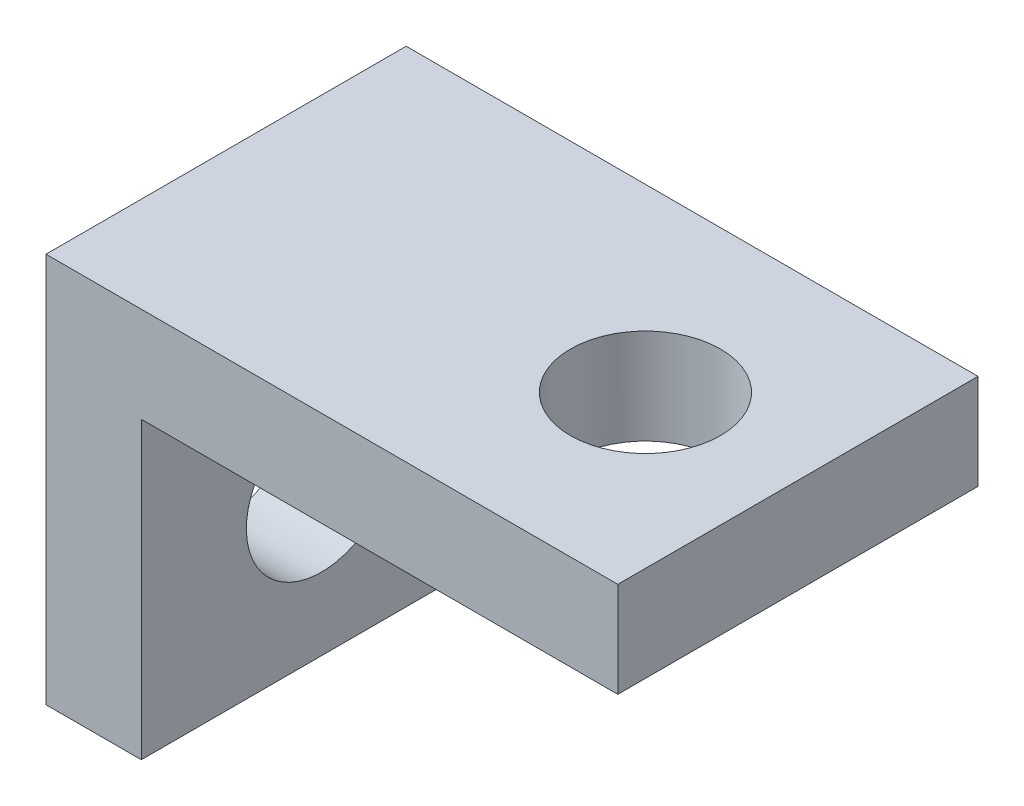
from build123d import *

# Parameters (mm, degrees)
BOSS_EXTRUDE1_DEPTH = 6
SKETCH2_R           = 1.25
CUT_EXTRUDE1_DEPTH  = 6
SKETCH3_R           = 1.25
CUT_EXTRUDE2_DEPTH  = 6


with BuildPart() as part:
    # Sketch1 → Boss-Extrude1 (new body)
    with BuildSketch(Plane.XY):
        Polygon((-0.381, 2.50825), (-0.381, -3.99175), (1.2065, -3.99175), (1.2065, 0.92075), (9.144, 0.92075), (9.144, 2.50825), align=None)
    extrude(amount=BOSS_EXTRUDE1_DEPTH)

    # Sketch2 → Cut-Extrude1 (cut)
    with BuildSketch(Plane(origin=(1.2065, 0, 0), x_dir=(0, 0, -1), z_dir=(1, 0, 0))):
        with Locations((-3, -1.5355)):
            Circle(SKETCH2_R)
    extrude(amount=-CUT_EXTRUDE1_DEPTH, mode=Mode.SUBTRACT)

    # Sketch3 → Cut-Extrude2 (cut)
    with BuildSketch(Plane.XZ.offset(-0.92075)):
        with Locations((6.604, 3)):
            Circle(SKETCH3_R)
    extrude(amount=-CUT_EXTRUDE2_DEPTH, mode=Mode.SUBTRACT)


solid = part.part
